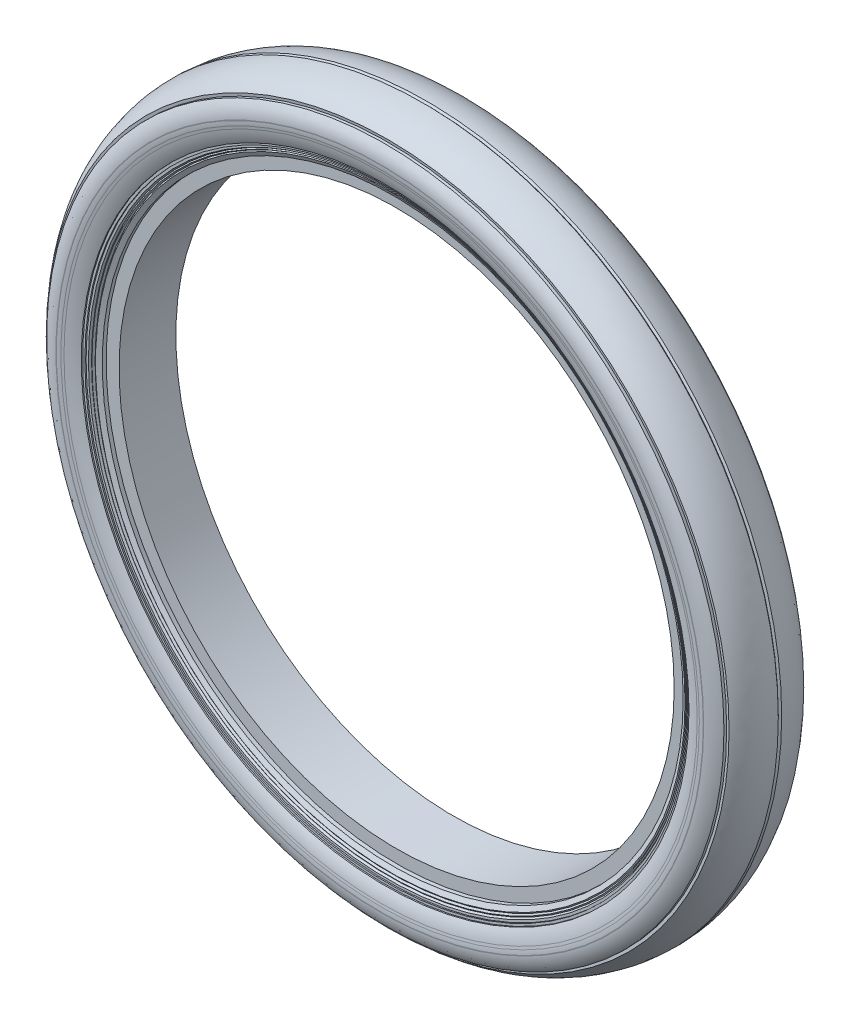
from build123d import *


with BuildPart() as part:
    # Эскиз2 → Повернуть1 (revolve)
    with BuildSketch(Plane(origin=(0, 0, 0), x_dir=(0, 0, -1), z_dir=(1, 0, 0))):
        with BuildLine():
            Line((0, 273.669789948), (-1.313227763, 274.983017711))
            add(Edge.make_bspline(
                [(-1.313227763, 274.983017711), (-18.97703865, 274.526009967), (-28.927587945, 264.459110615)],
                knots=[4.749918583, 4.749918583, 4.749918583, 5.685255053, 5.685255053, 5.685255053], degree=2, weights=[1, 0.892621888, 1]))
            Line((-28.927587945, 264.459110615), (-28.666473811, 262.350256404))
            Line((-28.666473811, 262.350256404), (-30.790209286, 262.350256404))
            add(Edge.make_bspline(
                [(-30.790209286, 262.350256404), (-35, 256.983356638), (-35, 250.882667615)],
                knots=[5.787662554, 5.787662554, 5.787662554, 6.283185307, 6.283185307, 6.283185307], degree=2, weights=[1, 0.969463838, 1]))
            Line((-35, 250.882667615), (-35, 250.537268265))
            ThreePointArc((-35, 250.537268265), (-34.931906754, 248.888300971), (-34.728090687, 247.250562031))
            Line((-34.728090687, 247.250562031), (-34.395586658, 245.254743371))
            ThreePointArc((-34.395586658, 245.254743371), (-33.077831675, 240.156872904), (-30.889076168, 235.367915727))
            Line((-30.889076168, 235.367915727), (-29.889076168, 235.367915727))
            Line((-29.889076168, 235.367915727), (-29.889076168, 233.607382253))
            Line((-29.889076168, 233.607382253), (-28.889076168, 233.607382253))
            Line((-28.889076168, 233.607382253), (-28.889076168, 231.846848779))
            Line((-28.889076168, 231.846848779), (-27.376943146, 230.94522145))
            Line((-27.376943146, 230.94522145), (-27.889076168, 230.086315304))
            Line((-27.889076168, 230.086315304), (-26.376943146, 229.184687976))
            Line((-26.376943146, 229.184687976), (-26.889076168, 228.32578183))
            Line((-26.889076168, 228.32578183), (-25, 225))
            Line((-25, 225), (-22, 225))
            Line((-22, 225), (-22, 215))
            Line((-22, 215), (22, 215))
            Line((22, 215), (22, 225))
            Line((22, 225), (25, 225))
            Line((25, 225), (26.889076168, 228.32578183))
            Line((26.889076168, 228.32578183), (26.376943146, 229.184687976))
            Line((26.376943146, 229.184687976), (27.889076168, 230.086315304))
            Line((27.889076168, 230.086315304), (27.376943146, 230.94522145))
            Line((27.376943146, 230.94522145), (28.889076168, 231.846848779))
            Line((28.889076168, 231.846848779), (28.889076168, 233.607382253))
            Line((28.889076168, 233.607382253), (29.889076168, 233.607382253))
            Line((29.889076168, 233.607382253), (29.889076168, 235.367915727))
            Line((29.889076168, 235.367915727), (30.889076168, 235.367915727))
            ThreePointArc((30.889076168, 235.367915727), (33.077831675, 240.156872904), (34.395586658, 245.254743371))
            Line((34.395586658, 245.254743371), (34.728090687, 247.250562031))
            ThreePointArc((34.728090687, 247.250562031), (34.931906754, 248.888300971), (35, 250.537268265))
            Line((35, 250.537268265), (35, 250.882667615))
            add(Edge.make_bspline(
                [(35, 250.882667615), (35, 256.983356638), (30.790209286, 262.350256404)],
                knots=[3.141592654, 3.141592654, 3.141592654, 3.637115407, 3.637115407, 3.637115407], degree=2, weights=[1, 0.969463838, 1]))
            Line((30.790209286, 262.350256404), (28.666473811, 262.350256404))
            Line((28.666473811, 262.350256404), (28.927587945, 264.459110615))
            add(Edge.make_bspline(
                [(28.927587945, 264.459110615), (18.97703865, 274.526009967), (1.313227763, 274.983017711)],
                knots=[3.739522908, 3.739522908, 3.739522908, 4.674859378, 4.674859378, 4.674859378], degree=2, weights=[1, 0.892621888, 1]))
            Line((1.313227763, 274.983017711), (0, 273.669789948))
        make_face()
    revolve(axis=Axis((0, 0, 22), (0, 0, -1)))


solid = part.part
